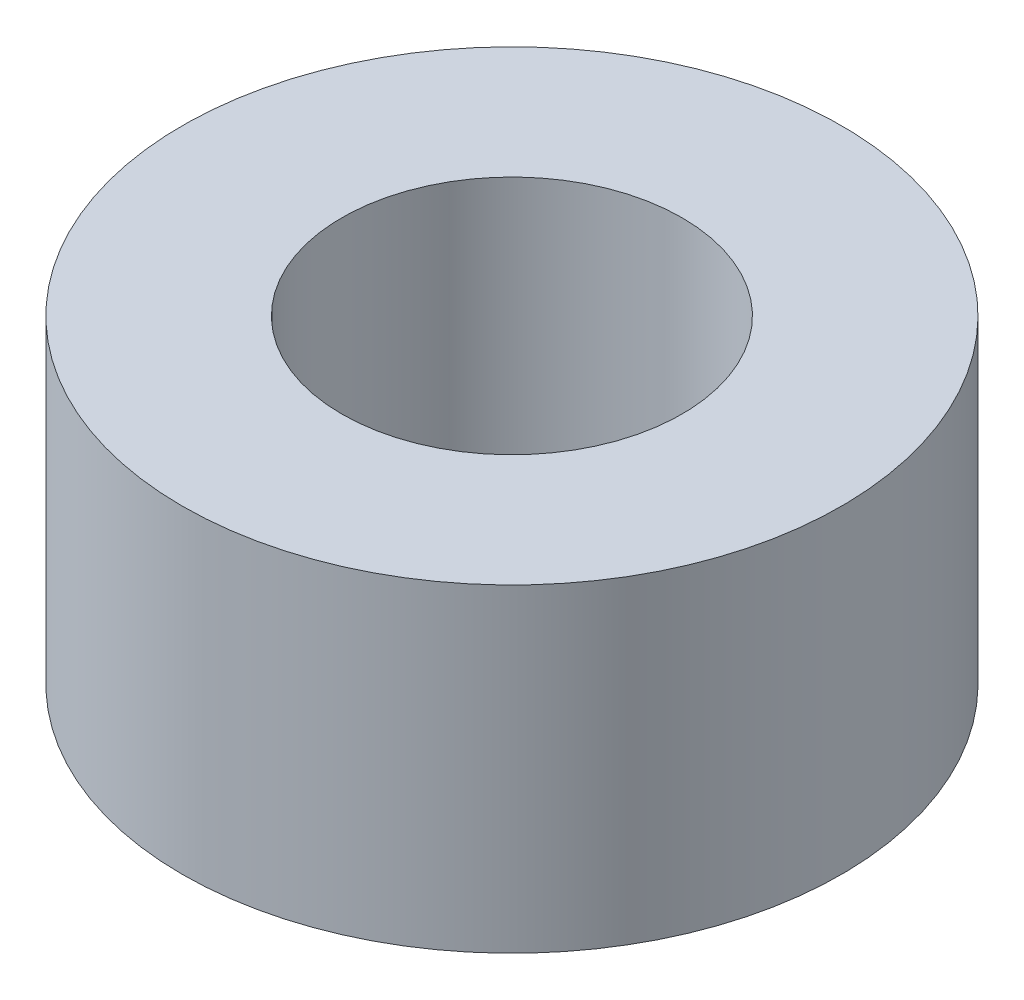
from build123d import *

# Parameters (mm, degrees)
ESQUISSE1_R        = 3.1
ESQUISSE1_R_2      = 1.6
BOSS_EXTRU_1_DEPTH = 3


with BuildPart() as part:
    # Esquisse1 → Boss.-Extru.1 (new body)
    with BuildSketch(Plane(origin=(0, 0, 0), x_dir=(1, 0, 0), z_dir=(0, 1, 0))):
        Circle(ESQUISSE1_R)
        Circle(ESQUISSE1_R_2, mode=Mode.SUBTRACT)
    extrude(amount=BOSS_EXTRU_1_DEPTH)


solid = part.part
